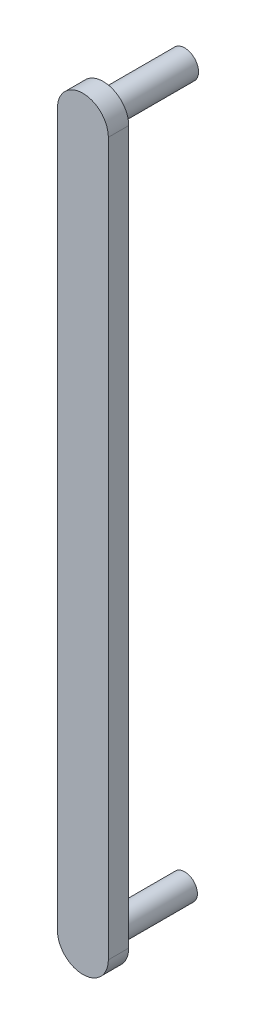
from build123d import *

# Parameters (mm, degrees)
SKETCH1_R           = 1.5875
BOSS_EXTRUDE1_DEPTH = 2.54
BOSS_EXTRUDE2_START = -12.7
SKETCH2_R           = 1.72979554
SKETCH2_R_2         = 1.5875
BOSS_EXTRUDE2_DEPTH = 12.7


with BuildPart() as part:
    # Sketch1 → Boss-Extrude1 (new body)
    with BuildSketch(Plane.XY):
        with BuildLine():
            Line((-3.175, 0), (-3.175, -88.9))
            ThreePointArc((-3.175, -88.9), (0, -92.075), (3.175, -88.9))
            Line((3.175, -88.9), (3.175, 0))
            ThreePointArc((3.175, 0), (0, 3.175), (-3.175, 0))
        make_face()
        Circle(SKETCH1_R, mode=Mode.SUBTRACT)
        with Locations((0, -88.9)):
            Circle(SKETCH1_R, mode=Mode.SUBTRACT)
    extrude(amount=BOSS_EXTRUDE1_DEPTH)

    # Sketch2 → Boss-Extrude2 (add)
    with BuildSketch(Plane.XY.offset(2.54).offset(BOSS_EXTRUDE2_START)):
        Circle(SKETCH2_R)
        with Locations((0, -88.9)):
            Circle(SKETCH2_R_2)
    extrude(amount=BOSS_EXTRUDE2_DEPTH)


solid = part.part
